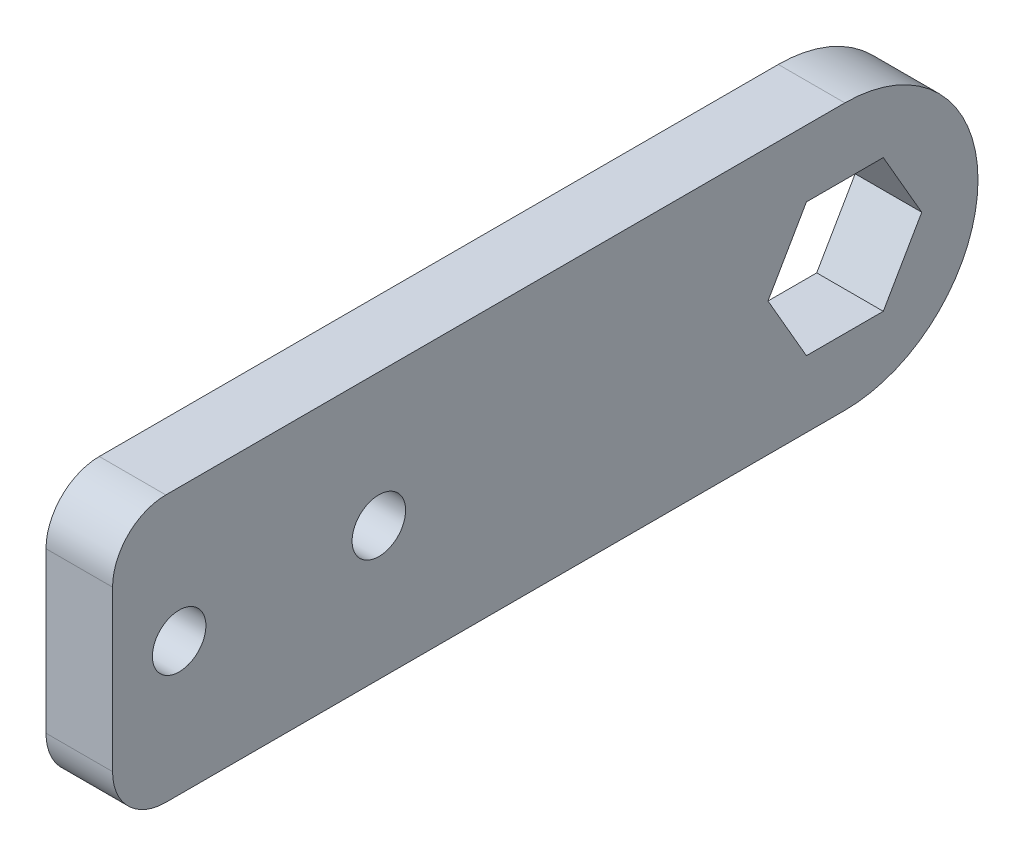
from build123d import *

# Parameters (mm, degrees)
SKETCH1_W              = 82.55
SKETCH1_H              = 25.4
BOSS_EXTRUDE1_DEPTH    = 3.175
FILLET1_R              = 12.7
F_10_CLEARANCE_HOLE1_D = 5.1054
FILLET2_R              = 5.08
CUT_EXTRUDE1_DEPTH     = 44.649033494


with BuildPart() as part:
    # Sketch1 → Boss-Extrude1 (new, symmetric)
    with BuildSketch(Plane(origin=(0, 0, 0), x_dir=(0, 0, -1), z_dir=(1, 0, 0))):
        Rectangle(SKETCH1_W, SKETCH1_H)
    extrude(amount=BOSS_EXTRUDE1_DEPTH, both=True)

    # Fillet1
    fillet1_edges = [part.edges().sort_by_distance(p)[0] for p in [
        (0, -12.7, -41.275),
        (0, 12.7, -41.275),
    ]]
    fillet(fillet1_edges, radius=FILLET1_R - 0.0001)  # a hair under: the kernel refuses the full size

    # #10 Clearance Hole1 (through all)
    with Locations(Plane(origin=(3.175, 6.272913445, 168.827028559), x_dir=(0, 0, -1), z_dir=(1, 0, 0))):
        with Locations((152.952028559, -6.272913445), (133.902028559, -6.272913445)):
            Hole(F_10_CLEARANCE_HOLE1_D / 2)

    # Fillet2
    fillet2_edges = [part.edges().sort_by_distance(p)[0] for p in [
        (0, -12.7, 41.275),
        (0, 12.7, 41.275),
    ]]
    fillet(fillet2_edges, radius=FILLET2_R)

    # Sketch7 → Cut-Extrude1 (cut, through all)
    with BuildSketch(Plane(origin=(3.175, 0, 0), x_dir=(0, 0, -1), z_dir=(1, 0, 0))):
        Polygon((32.241174209, 6.35), (24.908825791, 6.35), (21.242651581, 0), (24.908825791, -6.35), (32.241174209, -6.35), (35.907348419, 0), align=None)
    extrude(amount=-CUT_EXTRUDE1_DEPTH, mode=Mode.SUBTRACT)


solid = part.part
